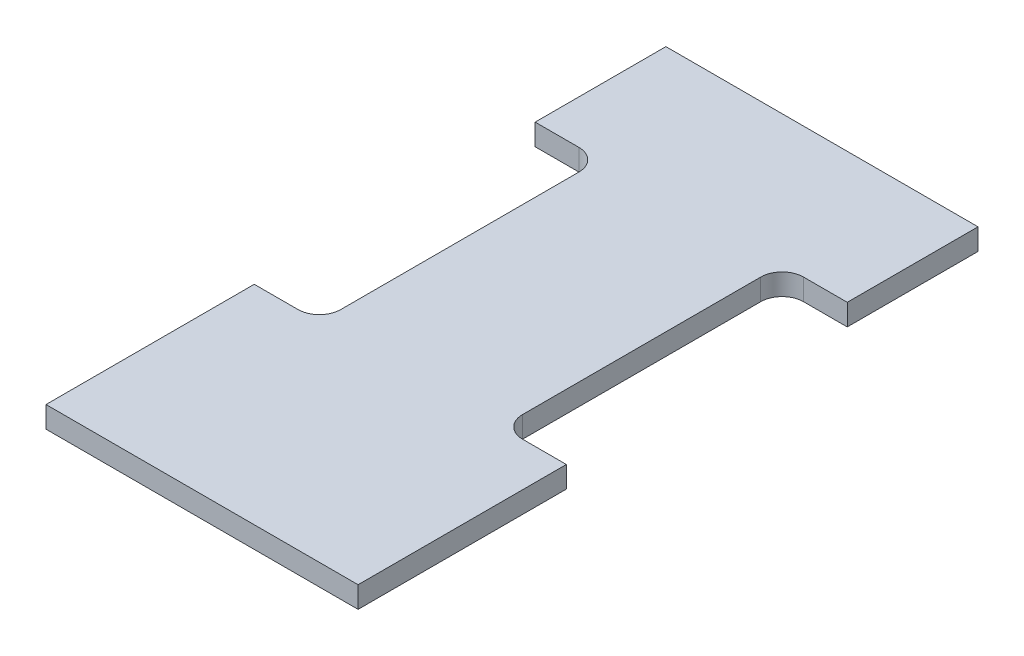
from build123d import *

# Parameters (mm, degrees)
BOSS_EXTRUDE1_DEPTH = 5


with BuildPart() as part:
    # Sketch1 → Boss-Extrude1 (new body)
    with BuildSketch(Plane(origin=(0, 0, 0), x_dir=(1, 0, 0), z_dir=(0, 1, 0))):
        with BuildLine():
            Line((-36.5, -72.5), (36.5, -72.5))
            Line((36.5, -72.5), (36.5, -23.786698854))
            Line((36.5, -23.786698854), (26.265669448, -23.786698854))
            ThreePointArc((26.265669448, -23.786698854), (22.730135542, -22.32223276), (21.265669448, -18.786698854))
            Line((21.265669448, -18.786698854), (21.265669448, 36.917121301))
            ThreePointArc((21.265669448, 36.917121301), (22.730135542, 40.452655207), (26.265669448, 41.917121301))
            Line((26.265669448, 41.917121301), (36.5, 41.917121301))
            Line((36.5, 41.917121301), (36.5, 72.5))
            Line((36.5, 72.5), (-36.5, 72.5))
            Line((-36.5, 72.5), (-36.5, 41.917121301))
            Line((-36.5, 41.917121301), (-26.265669448, 41.917121301))
            ThreePointArc((-26.265669448, 41.917121301), (-22.730135542, 40.452655207), (-21.265669448, 36.917121301))
            Line((-21.265669448, 36.917121301), (-21.265669448, -18.786698854))
            ThreePointArc((-21.265669448, -18.786698854), (-22.730135542, -22.32223276), (-26.265669448, -23.786698854))
            Line((-26.265669448, -23.786698854), (-36.5, -23.786698854))
            Line((-36.5, -23.786698854), (-36.5, -72.5))
        make_face()
    extrude(amount=BOSS_EXTRUDE1_DEPTH)


solid = part.part
